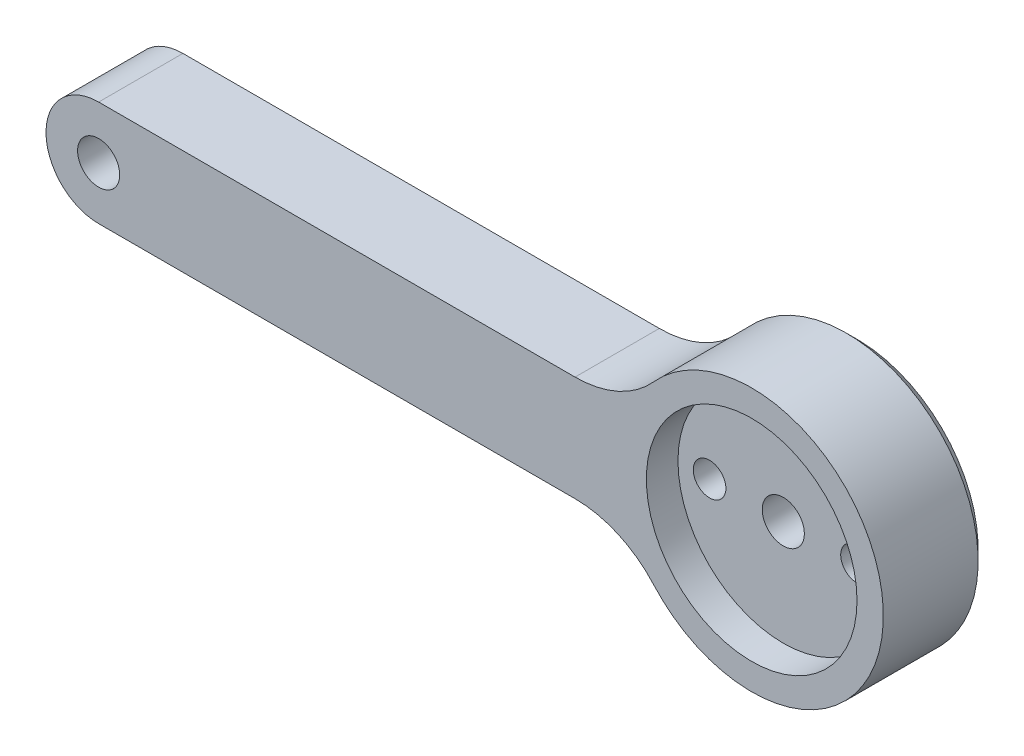
from build123d import *

# Parameters (mm, degrees)
SKETCH_2_R          = 2
EXTRUDE_1_DEPTH     = 8
SKETCH_3_R          = 12.5
SKETCH_3_R_2        = 10
EXTRUDE_2_DEPTH     = 8
EXTRUDE_START       = -5
SKETCH_4_R          = 10
SKETCH_4_R_2        = 2.013264837
EXTRUDE_3_DEPTH     = 5
SKETCH_5_R          = 10
CUT_EXTRUDE_1_DEPTH = 3
FILLET_1_R          = 10
SKETCH_6_R          = 1.55
CUT_EXTRUDE_2_DEPTH = 76.706670776
SKETCH_7_R          = 12.5
SKETCH_7_R_2        = 10.5
EXTRUDE_4_DEPTH     = 2
CHAMFER_1_SIZE      = 1
CUT_EXTRUDE_3_DEPTH = 1


with BuildPart() as part:
    # 草图2 → 凸台-拉伸1 (new body)
    with BuildSketch(Plane.XY):
        with BuildLine():
            Line((0, -5), (62, -5))
            ThreePointArc((62, -5), (67, 0), (62, 5))
            Line((62, 5), (0, 5))
            ThreePointArc((0, 5), (-5, 0), (0, -5))
        make_face()
        Circle(SKETCH_2_R, mode=Mode.SUBTRACT)
        with Locations((62, 0)):
            Circle(SKETCH_2_R, mode=Mode.SUBTRACT)
    extrude(amount=EXTRUDE_1_DEPTH)

    # 草图3 → 凸台-拉伸2 (add)
    with BuildSketch(Plane.XY.offset(8)):
        with Locations((62, 0)):
            Circle(SKETCH_3_R)
        with Locations((62, 0)):
            Circle(SKETCH_3_R_2, mode=Mode.SUBTRACT)
    extrude(amount=-EXTRUDE_2_DEPTH)

    # 草图4 → 凸台-拉伸3 (add)
    with BuildSketch(Plane(origin=(0, 0, 0), x_dir=(-1, 0, 0), z_dir=(0, 0, -1)).offset(EXTRUDE_START)):
        with Locations((-62, 0)):
            Circle(SKETCH_4_R)
        with Locations((-62, 0)):
            Circle(SKETCH_4_R_2, mode=Mode.SUBTRACT)
    extrude(amount=EXTRUDE_3_DEPTH)

    # 草图5 → 切除-拉伸1 (cut)
    with BuildSketch(Plane.XY.offset(8)):
        with Locations((62, 0)):
            Circle(SKETCH_5_R)
    extrude(amount=-CUT_EXTRUDE_1_DEPTH, mode=Mode.SUBTRACT)

    # 圆角1
    fillet_1_edges = [part.edges().sort_by_distance(p)[0] for p in [
        (50.543560763, 5, 4),
        (50.543560763, -5, 4),
    ]]
    fillet(fillet_1_edges, radius=FILLET_1_R)

    # 草图6 → 切除-拉伸2 (cut, through all)
    with BuildSketch(Plane.XY.offset(5)):
        with Locations((55, 0)):
            Circle(SKETCH_6_R)
        with Locations((69, 0)):
            Circle(SKETCH_6_R)
    extrude(amount=-CUT_EXTRUDE_2_DEPTH, mode=Mode.SUBTRACT)

    # 草图7 → 凸台-拉伸4 (add)
    with BuildSketch(Plane(origin=(0, 0, 0), x_dir=(-1, 0, 0), z_dir=(0, 0, -1))):
        with Locations(Location((-62, 0, 0), (0, 0, 318.189685104))):
            Circle(SKETCH_7_R)
        with Locations((-62, 0)):
            Circle(SKETCH_7_R_2, mode=Mode.SUBTRACT)
    extrude(amount=EXTRUDE_4_DEPTH)

    # 倒角1
    chamfer_1_edges = [part.edges().sort_by_distance(p)[0] for p in [
        (71.316949906, 8.333333333, -2),
        (72.5, 0, -2),
    ]]
    chamfer(chamfer_1_edges, length=CHAMFER_1_SIZE - 0.0001)  # a hair under: the kernel refuses the full size

    # 草图8 → 切除-拉伸3 (cut)
    with BuildSketch(Plane(origin=(0, 0, 0), x_dir=(-1, 0, 0), z_dir=(0, 0, -1))):
        Polygon((-40.404275713, 0), (-38.433846298, 2.955644123), (-34.921341688, 2.955644123), (-36.891771103, 0), (-34.921341688, -2.955644123), (-38.433846298, -2.955644123), align=None)
        Polygon((-30.404275713, 0), (-28.433846298, 2.955644123), (-24.921341688, 2.955644123), (-26.891771103, 0), (-24.921341688, -2.955644123), (-28.433846298, -2.955644123), align=None)
        Polygon((-20.404275713, 0), (-18.433846298, 2.955644123), (-14.921341688, 2.955644123), (-16.891771103, 0), (-14.921341688, -2.955644123), (-18.433846298, -2.955644123), align=None)
        Polygon((-10.404275713, 0), (-8.433846298, 2.955644123), (-4.921341688, 2.955644123), (-6.891771103, 0), (-4.921341688, -2.955644123), (-8.433846298, -2.955644123), align=None)
    extrude(amount=-CUT_EXTRUDE_3_DEPTH, mode=Mode.SUBTRACT)


solid = part.part
